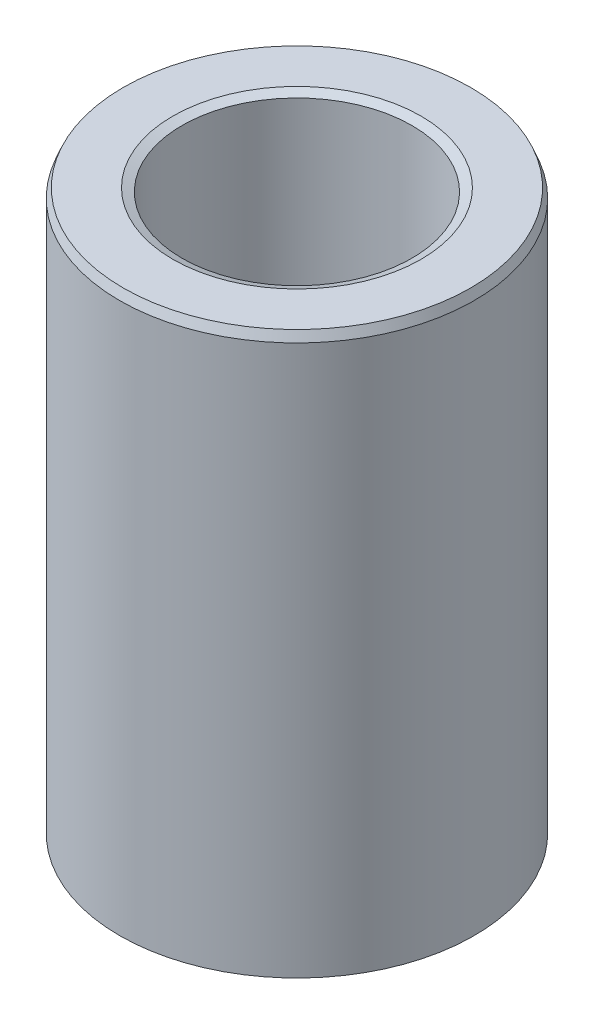
from build123d import *
from OCP.BRepFilletAPI import BRepFilletAPI_MakeChamfer

# Parameters (mm, degrees)
SKETCH1_R           = 35
BOSS_EXTRUDE1_DEPTH = 111.079061327
SKETCH2_R           = 22.698964018
CUT_EXTRUDE1_DEPTH  = 122.60821463
CHAMFER1_SIZE       = 1.796848407
CHAMFER1_SIZE2      = 0.710780725


with BuildPart() as part:
    # Sketch1 → Boss-Extrude1 (new body)
    with BuildSketch(Plane(origin=(0, 0, 0), x_dir=(1, 0, 0), z_dir=(0, 1, 0))):
        Circle(SKETCH1_R)
    extrude(amount=BOSS_EXTRUDE1_DEPTH)

    # Sketch2 → Cut-Extrude1 (cut, through all)
    with BuildSketch(Plane(origin=(0, 0, 0), x_dir=(1, 0, 0), z_dir=(0, 1, 0))):
        Circle(SKETCH2_R)
    extrude(amount=CUT_EXTRUDE1_DEPTH, mode=Mode.SUBTRACT)

    # Chamfer1: one chamfer whose edges measure the first distance from different faces: ONE call of the kernel's chamfer builder (chamfer() names one face for all edges)
    chamfer1_edges_1 = [part.edges().sort_by_distance(p)[0] for p in [
        (-22.698964018, 111.079061327, 0),
    ]]
    chamfer1_side_1 = [part.faces().sort_by_distance(p)[0] for p in [
        (-34.010050506, 111.079061327, 0),
    ]]
    chamfer1_edges_2 = [part.edges().sort_by_distance(p)[0] for p in [
        (-22.698964018, 0, 0),
    ]]
    chamfer1_side_2 = [part.faces().sort_by_distance(p)[0] for p in [
        (-22.698964018, 55.539530664, 0),
    ]]
    chamfer1_edges_3 = [part.edges().sort_by_distance(p)[0] for p in [
        (-35, 0, 0),
    ]]
    chamfer1_side_3 = [part.faces().sort_by_distance(p)[0] for p in [
        (-34.010050506, 0, 0),
    ]]
    chamfer1_edges_4 = [part.edges().sort_by_distance(p)[0] for p in [
        (-35, 111.079061327, 0),
    ]]
    chamfer1_side_4 = [part.faces().sort_by_distance(p)[0] for p in [
        (-35, 55.539530664, 0),
    ]]
    chamfer1 = BRepFilletAPI_MakeChamfer(part.part.solid().wrapped)
    for e in chamfer1_edges_1:
        chamfer1.Add(CHAMFER1_SIZE, CHAMFER1_SIZE2, e.wrapped, chamfer1_side_1[0].wrapped)  # the first distance lies on this face
    for e in chamfer1_edges_2:
        chamfer1.Add(CHAMFER1_SIZE, CHAMFER1_SIZE2, e.wrapped, chamfer1_side_2[0].wrapped)  # the first distance lies on this face
    for e in chamfer1_edges_3:
        chamfer1.Add(CHAMFER1_SIZE, CHAMFER1_SIZE2, e.wrapped, chamfer1_side_3[0].wrapped)  # the first distance lies on this face
    for e in chamfer1_edges_4:
        chamfer1.Add(CHAMFER1_SIZE, CHAMFER1_SIZE2, e.wrapped, chamfer1_side_4[0].wrapped)  # the first distance lies on this face
    add(Compound.cast(chamfer1.Shape()), mode=Mode.REPLACE)


solid = part.part
